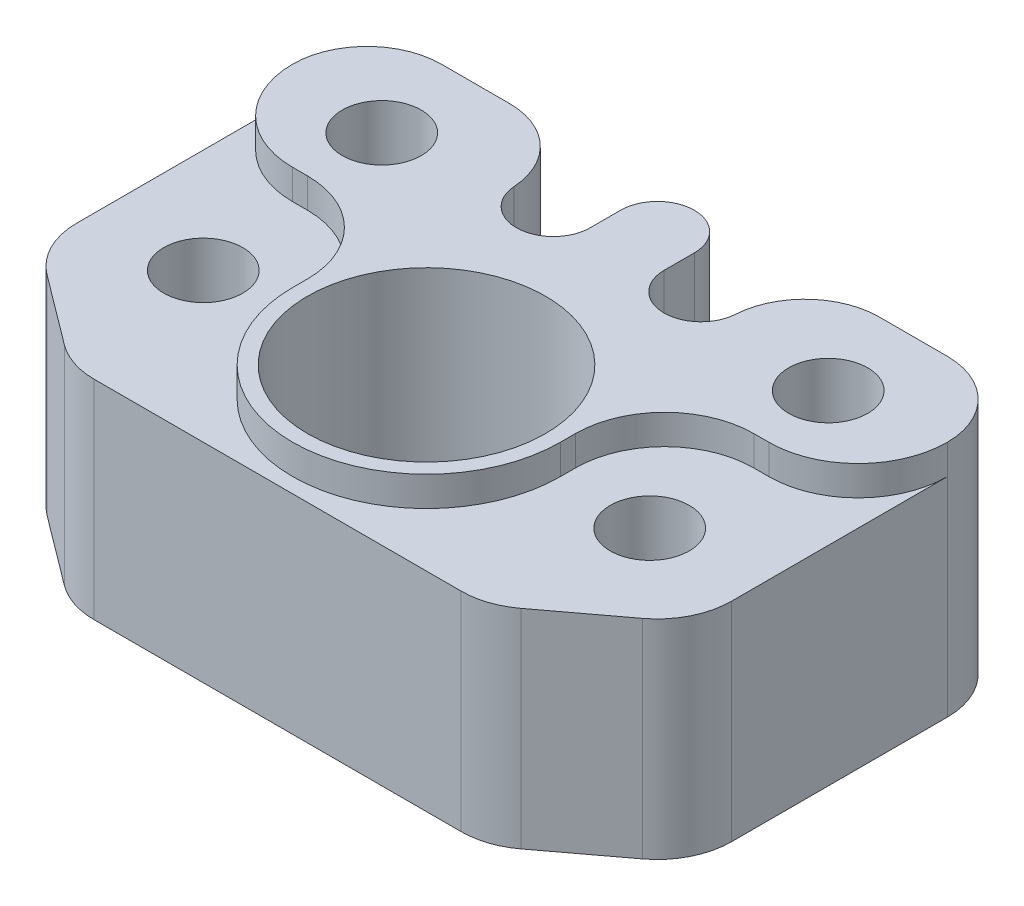
from build123d import *
from build123d.topology import SkipClean

# Parameters (mm, degrees)
BOSS_EXTRUDE1_DEPTH                                 = 22.225
FILLET1_R                                           = 3.937
FILLET3_R                                           = 7.9375
F_5_16_CLEARANCE_HOLE1_D                            = 8.4328
BOSS_EXTRUDE2_OUTLINE_R                             = 4.2164
BOSS_EXTRUDE2_DEPTH                                 = 3.175
FILLET4_R                                           = 9.525
FILLET5_R                                           = 9.525
SKETCH9_R                                           = 12.7
CUT_EXTRUDE1_DEPTH                                  = 19.177
CSK_FOR_5_16_FLAT_HEAD_MACHINE_SCREW_10_D           = 8.4328
CSK_FOR_5_16_FLAT_HEAD_MACHINE_SCREW_10_CSINK_D     = 16.129
CSK_FOR_5_16_FLAT_HEAD_MACHINE_SCREW_10_CSINK_ANGLE = 100


# Read off the part's stored shape, not the designer's step: Boss-Extrude2
with BuildPart() as part:
    # Sketch2 → Boss-Extrude1 (new body)
    with BuildSketch(Plane(origin=(0, 0, 0), x_dir=(1, 0, 0), z_dir=(0, 1, 0))):
        Polygon((-34.925, 28.575), (-11.811, 28.575), (-11.811, 17.4625), (-3.937, 17.4625), (-3.937, 28.575), (3.937, 28.575), (3.937, 17.4625), (11.811, 17.4625), (11.811, 28.575), (34.925, 28.575), (34.925, -6.35), (22.225, -15.875), (-22.225, -15.875), (-34.925, -6.35), align=None)
    extrude(amount=-BOSS_EXTRUDE1_DEPTH)

    # Fillet1
    fillet1_edges = [part.edges().sort_by_distance(p)[0] for p in [
        (3.937, -11.1125, -28.575),
        (-3.937, -11.1125, -28.575),
        (11.811, -11.1125, -17.4625),
        (3.937, -11.1125, -17.4625),
        (-3.937, -11.1125, -17.4625),
        (-11.811, -11.1125, -17.4625),
    ]]
    fillet(fillet1_edges, radius=FILLET1_R - 0.0001)  # a hair under: the kernel refuses the full size

    # Fillet3
    fillet3_edges = [part.edges().sort_by_distance(p)[0] for p in [
        (22.225, -11.1125, 15.875),
        (-22.225, -11.1125, 15.875),
        (-34.925, -11.1125, 6.35),
        (34.925, -11.1125, 6.35),
        (34.925, -11.1125, -28.575),
        (-34.925, -11.1125, -28.575),
        (-11.811, -11.1125, -28.575),
        (11.811, -11.1125, -28.575),
    ]]
    fillet(fillet3_edges, radius=FILLET3_R)

    # 5/16 Clearance Hole1 (through all)
    with Locations(Plane(origin=(0, 0, 0), x_dir=(1, 0, 0), z_dir=(0, 1, 0))):
        with Locations((-23.8252, 19.05), (23.7998, 19.05)):
            Hole(F_5_16_CLEARANCE_HOLE1_D / 2)

    # Boss-Extrude2 outline → Boss-Extrude2 (add)
    with SkipClean():  # the faces are left unmerged after this step: merging them gives an invalid solid
        with BuildSketch(Plane(origin=(0, 0, 0), x_dir=(1, 0, 0), z_dir=(0, 1, 0))):
            with BuildLine():
                ThreePointArc((-11.802885486, 21.146858289), (-14.294436515, 26.427445495), (-19.72402558, 28.575))
                Line((-19.72402558, 28.575), (-26.9875, 28.575))
                ThreePointArc((-26.9875, 28.575), (-32.600160076, 26.250160076), (-34.925, 20.6375))
                ThreePointArc((-34.925, 20.6375), (-32.135192091, 13.902307909), (-25.4, 11.1125))
                Line((-25.4, 11.1125), (-14.2875, 11.1125))
                Line((-14.2875, 11.1125), (-14.2875, 0))
                ThreePointArc((-14.2875, 0), (0, -14.2875), (14.2875, 0))
                Line((14.2875, 0), (14.2875, 11.1125))
                Line((14.2875, 11.1125), (25.4, 11.1125))
                ThreePointArc((25.4, 11.1125), (32.135192091, 13.902307909), (34.925, 20.6375))
                ThreePointArc((34.925, 20.6375), (32.600160076, 26.250160076), (26.9875, 28.575))
                Line((26.9875, 28.575), (19.72402558, 28.575))
                ThreePointArc((19.72402558, 28.575), (14.294436515, 26.427445495), (11.802885486, 21.146858289))
                ThreePointArc((11.802885486, 21.146858289), (7.747614004, 17.464529151), (3.937, 21.3995))
                Line((3.937, 21.3995), (3.937, 24.638))
                ThreePointArc((3.937, 24.638), (0, 28.575), (-3.937, 24.638))
                Line((-3.937, 24.638), (-3.937, 21.3995))
                ThreePointArc((-3.937, 21.3995), (-7.747614004, 17.464529151), (-11.802885486, 21.146858289))
            make_face()
            with Locations((-23.8252, 19.05)):
                Circle(BOSS_EXTRUDE2_OUTLINE_R, mode=Mode.SUBTRACT)
            with Locations((23.7998, 19.05)):
                Circle(BOSS_EXTRUDE2_OUTLINE_R, mode=Mode.SUBTRACT)
        extrude(amount=BOSS_EXTRUDE2_DEPTH)
    add(part.part.scale(1), mode=Mode.REPLACE)  # the faces are merged on a copy

    # Fillet4
    fillet4_edges = [part.edges().sort_by_distance(p)[0] for p in [
        (-14.2875, 1.5875, -11.1125),
    ]]
    fillet(fillet4_edges, radius=FILLET4_R)

    # Fillet5
    fillet5_edges = [part.edges().sort_by_distance(p)[0] for p in [
        (14.2875, 1.5875, -11.1125),
    ]]
    fillet(fillet5_edges, radius=FILLET5_R)

    # Sketch9 → Cut-Extrude1 (cut)
    with SkipClean():  # the faces are left unmerged after this step: merging them gives an invalid solid
        with BuildSketch(Plane(origin=(0, 3.175, 0), x_dir=(1, 0, 0), z_dir=(0, 1, 0))):
            with Locations(Location((0, 0, 0), (0, 0, 270))):
                Circle(SKETCH9_R)
        extrude(amount=-CUT_EXTRUDE1_DEPTH, mode=Mode.SUBTRACT)

    # CSK for 5/16 Flat Head Machine Screw (100)2 (through all)
    with Locations(Plane(origin=(0, -22.225, 0), x_dir=(-1, 0, 0), z_dir=(0, -1, 0))):
        with Locations((-23.8125, 0), (23.8125, 0)):
            CounterSinkHole(CSK_FOR_5_16_FLAT_HEAD_MACHINE_SCREW_10_D / 2, CSK_FOR_5_16_FLAT_HEAD_MACHINE_SCREW_10_CSINK_D / 2, counter_sink_angle=CSK_FOR_5_16_FLAT_HEAD_MACHINE_SCREW_10_CSINK_ANGLE)


solid = part.part
